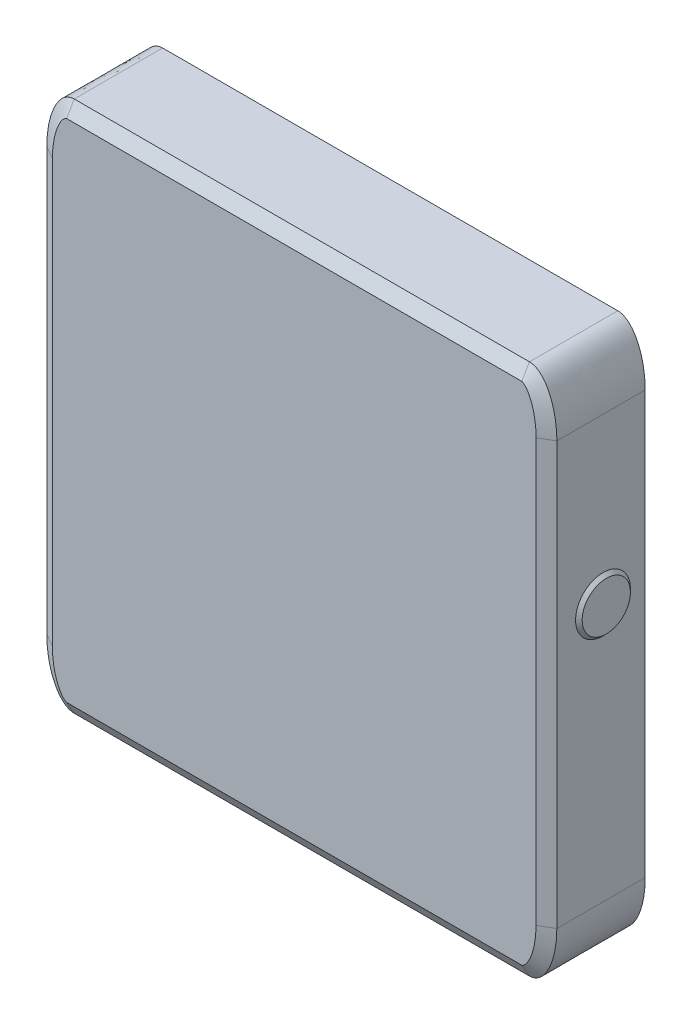
from build123d import *

# Parameters (mm, degrees)
SKETCH1_W           = 93
SKETCH1_H           = 97
BOSS_EXTRUDE1_DEPTH = 17.5
FILLET1_SIZE        = 5
FILLET1_SIZE_2      = 10
FILLET2_SIZE        = 10
FILLET2_SIZE_2      = 5
FILLET3_SIZE        = 5
FILLET3_SIZE_2      = 10
SKETCH2_R           = 1.28
SKETCH2_W           = 7.34
SKETCH2_H           = 2.56
CUT_EXTRUDE1_DEPTH  = 11.3
SKETCH3_R           = 5
BOSS_EXTRUDE2_DEPTH = 0.6
CHAMFER1_SIZE       = 0.6
CUT_EXTRUDE2_DEPTH  = 0.2
CHAMFER4_SIZE       = 2.4
CHAMFER4_SIZE2      = 1.385640646
SKETCH5_R           = 2
CUT_EXTRUDE3_DEPTH  = 5


# Some blends are built 0.0001 mm under size
with BuildPart() as part:
    # Sketch1 → Boss-Extrude1 (new body)
    with BuildSketch(Plane.XY):
        Rectangle(SKETCH1_W, SKETCH1_H)
    extrude(amount=BOSS_EXTRUDE1_DEPTH)

    # Fillet1
    # an asymmetric fillet: 10, 5 mm, written as the material it takes off along each edge
    with BuildSketch(Plane(origin=(-46.5, 48.5, -25), x_dir=(1, 0, 0), z_dir=(0, 0, 1))) as fillet1_piece_1:
        with BuildLine():
            Bezier((FILLET1_SIZE, 0), (0, 0), (0, -FILLET1_SIZE_2), weights=[1, 0.707106781, 1])
            Line((0, -FILLET1_SIZE_2), (0, 0))
            Line((0, 0), (FILLET1_SIZE, 0))
        make_face()
    extrude(amount=67.5, mode=Mode.SUBTRACT)
    with BuildSketch(Plane(origin=(46.5, -48.5, -25), x_dir=(0, 1, 0), z_dir=(0, 0, 1))) as fillet1_piece_2:
        with BuildLine():
            Bezier((FILLET1_SIZE_2, 0), (0, 0), (0, FILLET1_SIZE), weights=[1, 0.707106781, 1])
            Line((0, FILLET1_SIZE), (0, 0))
            Line((0, 0), (FILLET1_SIZE_2, 0))
        make_face()
    extrude(amount=67.5, mode=Mode.SUBTRACT)

    # Fillet2
    # an asymmetric fillet: 10, 5 mm, written as the material it takes off along each edge
    with BuildSketch(Plane(origin=(-46.5, -48.5, -25), x_dir=(0, 1, 0), z_dir=(0, 0, 1))) as fillet2_piece_1:
        with BuildLine():
            Bezier((FILLET2_SIZE, 0), (0, 0), (0, -FILLET2_SIZE_2), weights=[1, 0.707106781, 1])
            Line((0, -FILLET2_SIZE_2), (0, 0))
            Line((0, 0), (FILLET2_SIZE, 0))
        make_face()
    extrude(amount=67.5, mode=Mode.SUBTRACT)

    # Fillet3
    # an asymmetric fillet: 10, 5 mm, written as the material it takes off along each edge
    with BuildSketch(Plane(origin=(46.5, 48.5, -25), x_dir=(-1, 0, 0), z_dir=(0, 0, 1))) as fillet3_piece_1:
        with BuildLine():
            Bezier((FILLET3_SIZE, 0), (0, 0), (0, FILLET3_SIZE_2), weights=[1, 0.707106781, 1])
            Line((0, FILLET3_SIZE_2), (0, 0))
            Line((0, 0), (FILLET3_SIZE, 0))
        make_face()
    extrude(amount=67.5, mode=Mode.SUBTRACT)

    # Sketch2 → Cut-Extrude1 (cut)
    with BuildSketch(Plane.XZ.offset(48.5)):
        with Locations((-3.67, 8.75)):
            Circle(SKETCH2_R)
        with Locations((3.67, 8.75)):
            Circle(SKETCH2_R)
        with Locations((0, 8.75)):
            Rectangle(SKETCH2_W, SKETCH2_H)
    extrude(amount=-CUT_EXTRUDE1_DEPTH, mode=Mode.SUBTRACT)

    # Sketch3 → Boss-Extrude2 (add)
    with BuildSketch(Plane(origin=(46.5, 0, 0), x_dir=(0, 0, -1), z_dir=(1, 0, 0))):
        with Locations(Location((-7.7, 8.5, 0), (0, 0, 270))):
            Circle(SKETCH3_R)
    extrude(amount=BOSS_EXTRUDE2_DEPTH)

    # Chamfer1
    chamfer1_edges = [part.edges().sort_by_distance(p)[0] for p in [
        (47.1, 13.5, 7.7),
    ]]
    chamfer(chamfer1_edges, length=CHAMFER1_SIZE - 0.0001)  # a hair under: the kernel refuses the full size

    # Sketch4 → Cut-Extrude2 (cut)
    with BuildSketch(Plane.ZY.offset(46.5)):
        with BuildLine():
            Line((3, 34.5), (13.7, 34.5))
            ThreePointArc((13.7, 34.5), (14.407106781, 34.207106781), (14.7, 33.5))
            Line((14.7, 33.5), (14.7, 6.8))
            ThreePointArc((14.7, 6.8), (14.407106781, 6.092893219), (13.7, 5.8))
            Line((13.7, 5.8), (3, 5.8))
            ThreePointArc((3, 5.8), (2.292893219, 6.092893219), (2, 6.8))
            Line((2, 6.8), (2, 33.5))
            ThreePointArc((2, 33.5), (2.292893219, 34.207106781), (3, 34.5))
        make_face()
    extrude(amount=-CUT_EXTRUDE2_DEPTH, mode=Mode.SUBTRACT)

    # Chamfer4
    chamfer4_edges = [part.edges().sort_by_distance(p)[0] for p in [
        (-45.520581957, 44.444718915, 17.5),
        (-46.5, 0, 17.5),
        (0, 48.5, 17.5),
        (-45.52058196, -44.444718917, 17.5),
        (45.520581957, 44.444718915, 17.5),
        (0, -48.5, 17.5),
        (46.5, 0, 17.5),
        (45.52058196, -44.444718917, 17.5),
    ]]
    chamfer4_side = [part.faces().sort_by_distance(p)[0] for p in [
        (0, 4.215e-06, 17.5),
    ]]
    chamfer(chamfer4_edges, length=CHAMFER4_SIZE, length2=CHAMFER4_SIZE2, reference=chamfer4_side[0])

    # Sketch5 → Cut-Extrude3 (cut)
    with BuildSketch(Plane(origin=(0, 0, 0), x_dir=(-1, 0, 0), z_dir=(0, 0, -1))):
        with Locations((0, 29.5)):
            Circle(SKETCH5_R)
    extrude(amount=-CUT_EXTRUDE3_DEPTH, mode=Mode.SUBTRACT)


solid = part.part
